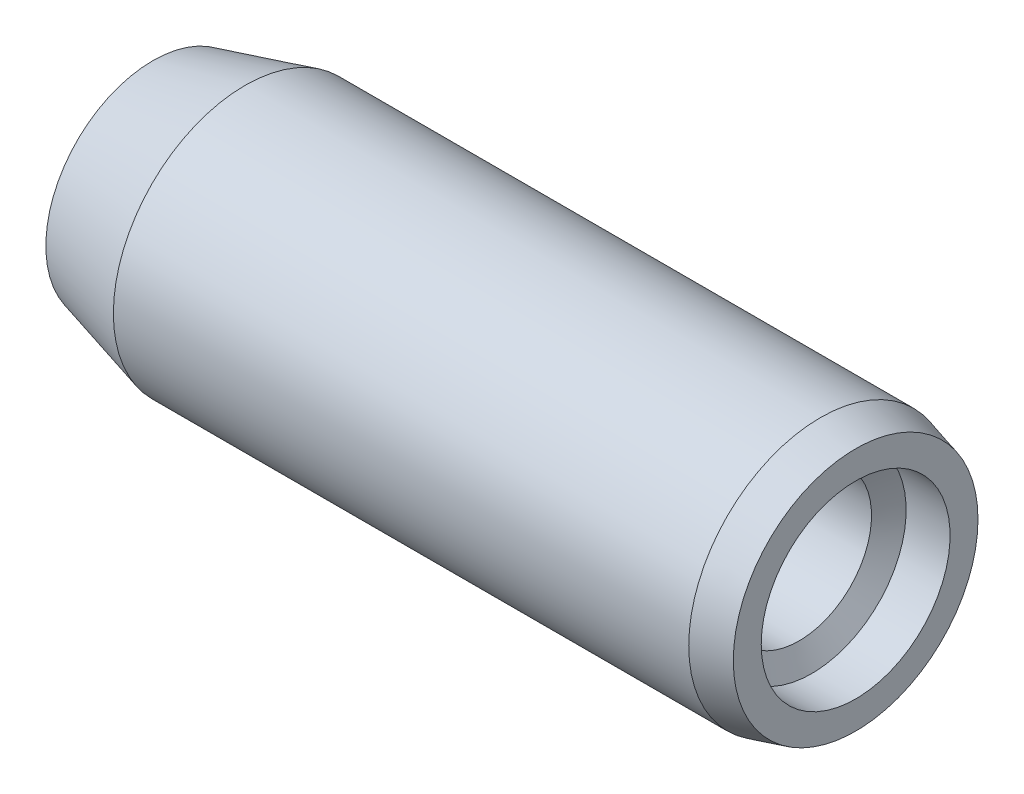
from build123d import *


with BuildPart() as part:
    # Sketch1 → Base-Revolve (revolve)
    with BuildSketch(Plane.XY):
        with BuildLine():
            Line((0.590443768, 2.595515627), (2.1, 3))
            Line((2.1, 3), (15.2, 3))
            Line((15.2, 3), (16, 2.785640646))
            Line((16, 2.785640646), (16, 0))
            Line((16, 0), (0, 0))
            ThreePointArc((0, 0), (0.149472785, 1.33091371), (0.590443768, 2.595515627))
        make_face()
    revolve(axis=Axis((-3.862476542, 0, 0), (1, 0, 0)))

    # Sketch2 → Base-Revolve2 (revolve)
    with BuildSketch(Plane.XY):
        Polygon((0, 0), (0, 2.437306696), (2.1, 3), (15.2, 3), (16, 2.785640646), (16, 0), align=None)
    revolve(axis=Axis((0, 0, 0), (-1, 0, 0)))

    # Sketch3 → TypeA (revolve, cut)
    with BuildSketch(Plane.XY):
        Polygon((16, 2.15), (16.2, 2.15), (16.2, 0), (16, 0), (5.047372056, 0), (6, 1.65), (14.711324865, 1.65), (15, 2.15), align=None)
    revolve(axis=Axis((16, 0, 0), (1, 0, 0)), mode=Mode.SUBTRACT)


solid = part.part
